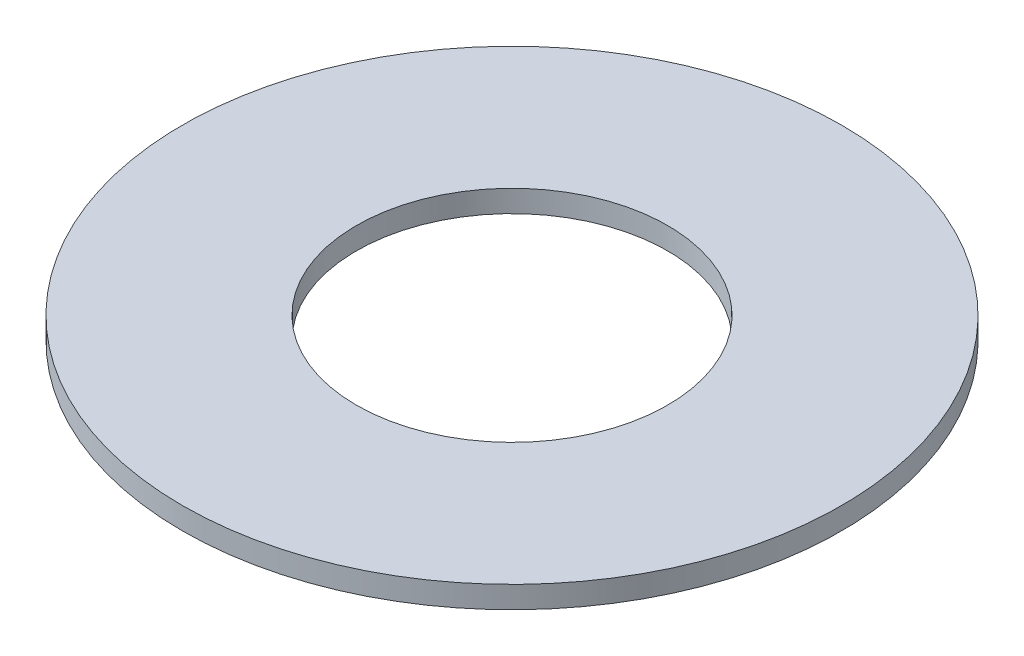
from build123d import *

# Parameters (mm, degrees)
SKETCH1_R           = 90
BOSS_EXTRUDE1_DEPTH = 6
SKETCH2_R           = 42.5
CUT_EXTRUDE1_DEPTH  = 128.42056349


with BuildPart() as part:
    # Sketch1 → Boss-Extrude1 (new body)
    with BuildSketch(Plane(origin=(0, 0, 0), x_dir=(1, 0, 0), z_dir=(0, 1, 0))):
        Circle(SKETCH1_R)
    extrude(amount=BOSS_EXTRUDE1_DEPTH)

    # Sketch2 → Cut-Extrude1 (cut, through all)
    with BuildSketch(Plane(origin=(0, 0, 0), x_dir=(1, 0, 0), z_dir=(0, 1, 0))):
        Circle(SKETCH2_R)
    extrude(amount=CUT_EXTRUDE1_DEPTH, mode=Mode.SUBTRACT)


solid = part.part
